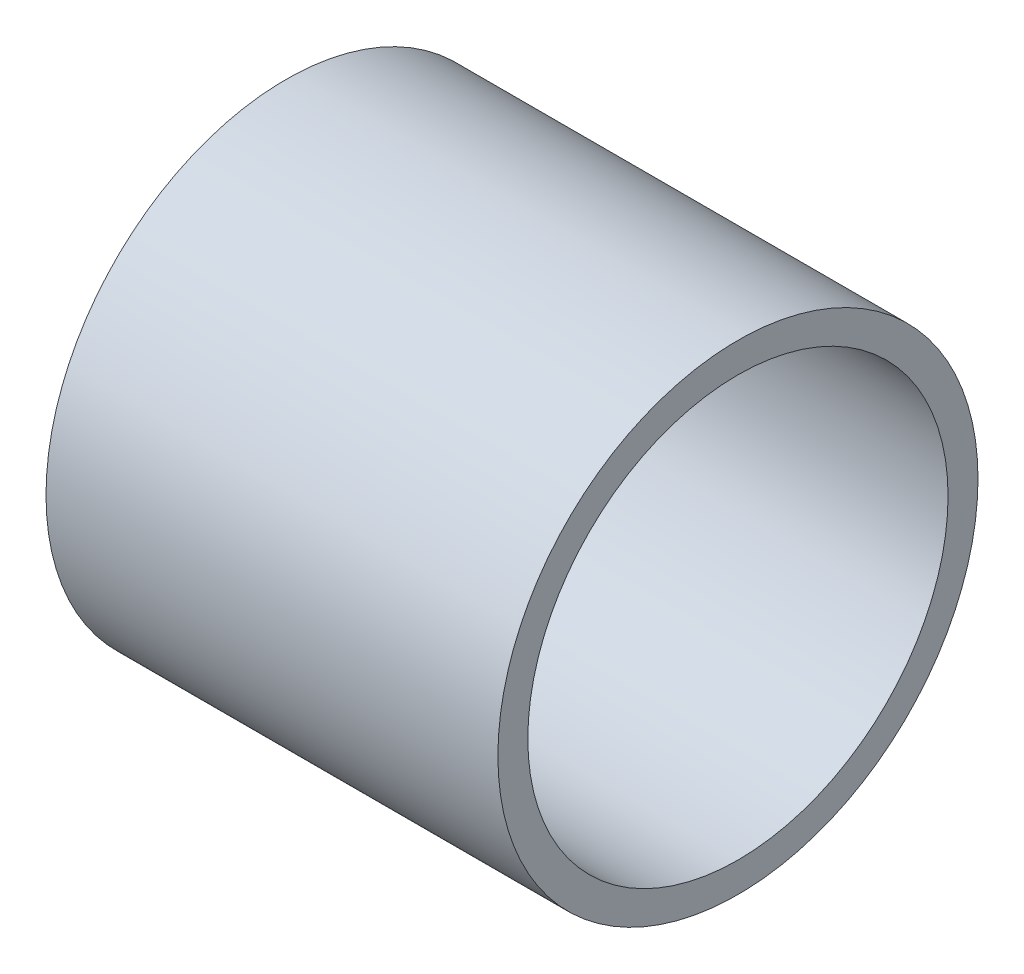
from build123d import *

# Parameters (mm, degrees)
SKETCH2_W = 304.8
SKETCH2_H = 20.193


with BuildPart() as part:
    # Sketch2 → Revolve1 (revolve)
    with BuildSketch(Plane.XY):
        with Locations((152.4, 151.8285)):
            Rectangle(SKETCH2_W, SKETCH2_H)
    revolve(axis=Axis((0, 0, 0), (1, 0, 0)))


solid = part.part
